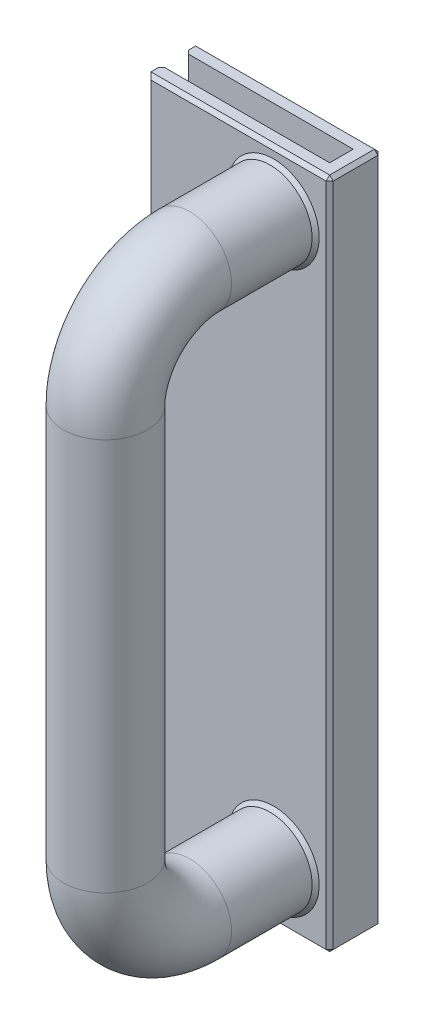
from build123d import *

# Parameters (mm, degrees)
BOSS_EXTRUDE1_DEPTH = 152.4
SKETCH2_R           = 9.525
CHAMFER1_SIZE       = 0.8


with BuildPart() as part:
    # Sketch1 → Boss-Extrude1 (new body)
    with BuildSketch(Plane(origin=(0, 0, 0), x_dir=(1, 0, 0), z_dir=(0, 1, 0))):
        Polygon((-19.05, 2.667), (19.05, 2.667), (19.05, -2.667), (-19.05, -2.667), (-19.05, -5.867), (22.25, -5.867), (22.25, 5.867), (-19.05, 5.867), align=None)
    extrude(amount=BOSS_EXTRUDE1_DEPTH)

    # Sweep1: sweep along a curve in space
    with BuildLine() as sweep1_path:
        Line((9.55, 12.7, 5.867), (9.55, 12.7, 24.917))
        ThreePointArc((9.55, 12.7, 24.917), (9.55, 18.279615818, 38.387384182), (9.55, 31.75, 43.967))
        Line((9.55, 31.75, 43.967), (9.55, 120.65, 43.967))
        ThreePointArc((9.55, 120.65, 43.967), (9.55, 134.120384182, 38.387384182), (9.55, 139.7, 24.917))
        Line((9.55, 139.7, 24.917), (9.55, 139.7, 5.867))
    # Sketch2 → Sweep1 (sweep)
    with BuildSketch(Plane.XY.offset(5.867)):
        with Locations((9.55, 12.7)):
            Circle(SKETCH2_R)
    sweep(path=sweep1_path.line)

    # Chamfer1
    chamfer1_edges = [part.edges().sort_by_distance(p)[0] for p in [
        (-19.05, 76.2, -2.667),
        (-19.05, 76.2, 2.667),
        (1.6, 0, -5.867),
        (22.25, 0, 0),
        (1.6, 0, 5.867),
        (22.25, 76.2, -5.867),
        (22.25, 76.2, 5.867),
        (-19.05, 76.2, -5.867),
        (1.6, 152.4, -5.867),
        (22.25, 152.4, 0),
        (1.6, 152.4, 5.867),
        (-19.05, 76.2, 5.867),
        (0.025, 12.7, 5.867),
        (0.025, 139.7, 5.867),
    ]]
    chamfer(chamfer1_edges, length=CHAMFER1_SIZE)


solid = part.part
